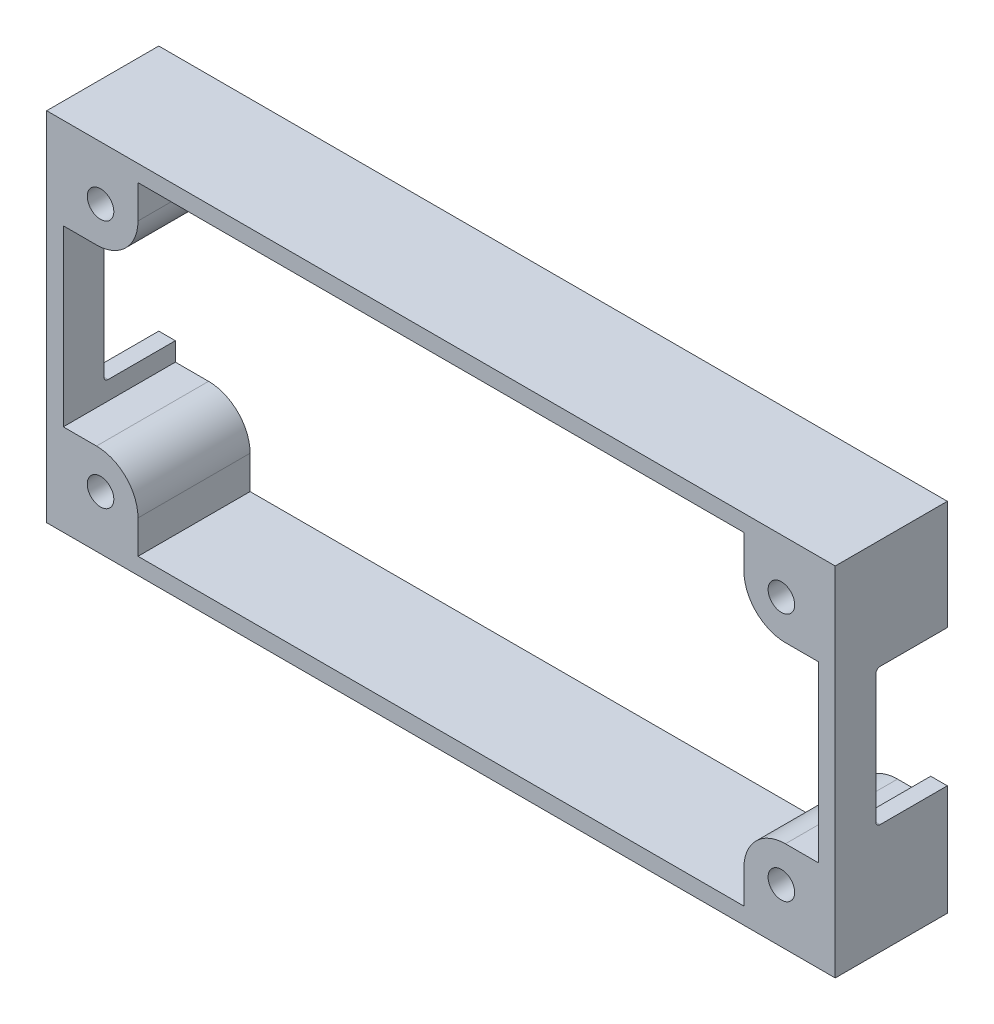
from build123d import *

# Parameters (mm, degrees)
SKETCH_1_W          = 94.97478029
SKETCH_1_H          = 42.97467615
SKETCH_1_W_2        = 90.97478029
SKETCH_1_H_2        = 38.97467615
EXTRUDE_1_DEPTH     = 13.5
SKETCH_2_W          = 9
SKETCH_2_H          = 9
EXTRUDE_2_DEPTH     = 13.5
SKETCH_3_R          = 1.6
CUT_EXTRUDE_1_DEPTH = 13.5
SKETCH_4_W          = 2
SKETCH_4_H          = 16.5
CUT_EXTRUDE_2_DEPTH = 8.6
FILLET_1_R          = 5
FILLET_2_R          = 0.5


with BuildPart() as part:
    # 草图1 → 凸台-拉伸1 (new body)
    with BuildSketch(Plane.XY.offset(1.6000508)):
        with Locations((45.00009017, -19.0000381)):
            Rectangle(SKETCH_1_W, SKETCH_1_H)
        with Locations((45.00009017, -19.0000381)):
            Rectangle(SKETCH_1_W_2, SKETCH_1_H_2, mode=Mode.SUBTRACT)
    extrude(amount=EXTRUDE_1_DEPTH)

    # 草图2 → 凸台-拉伸2 (add)
    with BuildSketch(Plane.XY.offset(1.6000508)):
        with Locations((4.012700025, -4.012700025)):
            Rectangle(SKETCH_2_W, SKETCH_2_H)
        with Locations((85.987480315, -4.012700025)):
            Rectangle(SKETCH_2_W, SKETCH_2_H)
        with Locations((4.012700025, -33.987376175)):
            Rectangle(SKETCH_2_W, SKETCH_2_H)
        with Locations((85.987480315, -33.987376175)):
            Rectangle(SKETCH_2_W, SKETCH_2_H)
    extrude(amount=EXTRUDE_2_DEPTH)

    # 草图3 → 切除-拉伸1 (cut)
    with BuildSketch(Plane.XY.offset(1.6000508)):
        with Locations((4.00000762, -4.00000762)):
            Circle(SKETCH_3_R)
        with Locations((86.00017272, -4.00000762)):
            Circle(SKETCH_3_R)
        with Locations((86.00017272, -34.00006858)):
            Circle(SKETCH_3_R)
        with Locations((4.00000762, -34.00006858)):
            Circle(SKETCH_3_R)
    extrude(amount=CUT_EXTRUDE_1_DEPTH, mode=Mode.SUBTRACT)

    # 草图4 → 切除-拉伸2 (cut)
    with BuildSketch(Plane.XY.offset(1.6000508)):
        with Locations((-1.487299975, -18.9999873)):
            Rectangle(SKETCH_4_W, SKETCH_4_H)
        with Locations((91.487480315, -18.939077978)):
            Rectangle(SKETCH_4_W, SKETCH_4_H)
    extrude(amount=CUT_EXTRUDE_2_DEPTH, mode=Mode.SUBTRACT)

    # 圆角1
    fillet_1_edges = [part.edges().sort_by_distance(p)[0] for p in [
        (81.487480315, -29.487376175, 8.3500508),
        (8.512700025, -29.487376175, 8.3500508),
        (81.487480315, -8.512700025, 8.3500508),
        (8.512700025, -8.512700025, 8.3500508),
    ]]
    fillet(fillet_1_edges, radius=FILLET_1_R)

    # 圆角2
    fillet_2_edges = [part.edges().sort_by_distance(p)[0] for p in [
        (91.487480315, -27.189077978, 10.2000508),
        (91.487480315, -10.689077978, 10.2000508),
        (-1.487299975, -27.2499873, 10.2000508),
        (-1.487299975, -10.7499873, 10.2000508),
    ]]
    fillet(fillet_2_edges, radius=FILLET_2_R)


solid = part.part
